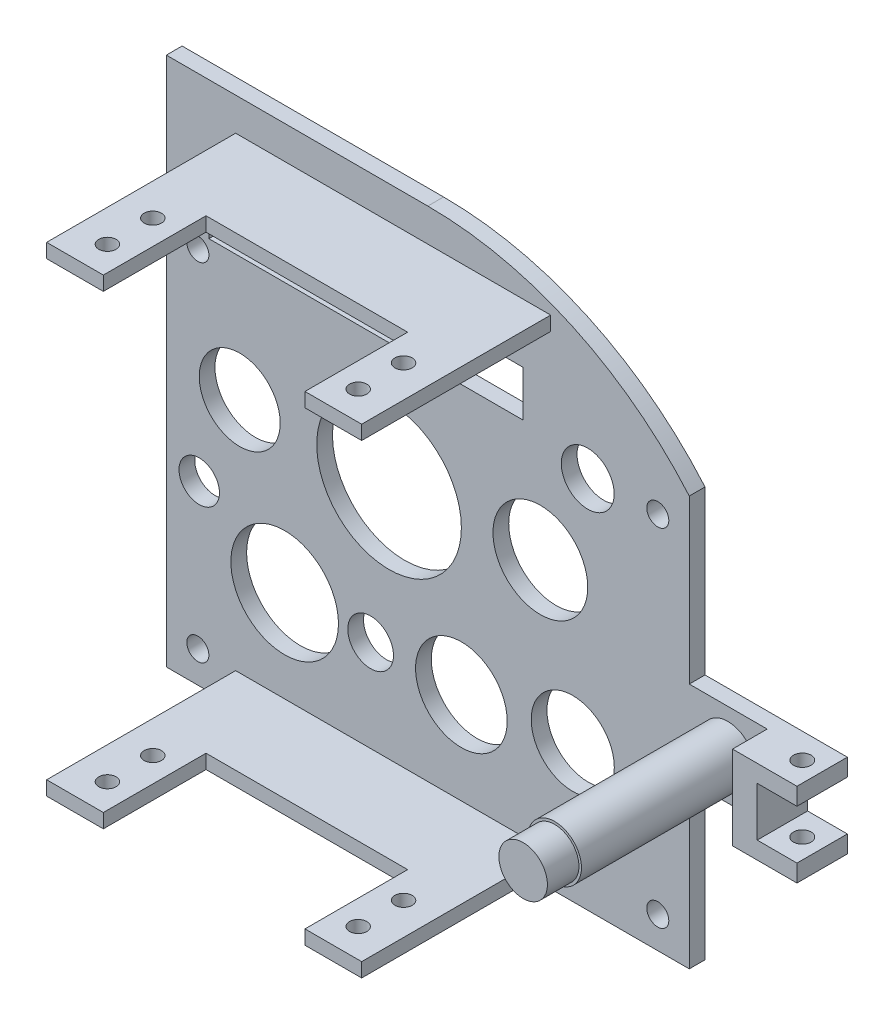
from build123d import *

# Parameters (mm, degrees)
SKETCH1_R                      = 1.75
BOSS_EXTRUDE1_DEPTH            = 2.5
CUT_EXTRUDE1_DEPTH             = 72.5
SKETCH3_3_W                    = 50
SKETCH3_3_H                    = 2.25
BOSS_EXTRUDE2_DEPTH            = 30
SKETCH6_R                      = 1.375
SKETCH6_W                      = 32
SKETCH6_H                      = 16.3
CUT_EXTRUDE2_DEPTH             = 105.230334086
SKETCH2_R                      = 4.25
BOSS_EXTRUDE4_DEPTH            = 27.5
SKETCH7_R                      = 3.85
BOSS_EXTRUDE5_DEPTH            = 5
BOSS_EXTRUDE6_DEPTH            = 5.5
CUT_EXTRUDE3_REACH             = 83.788
SKETCH10_R                     = 1.4
CUT_EXTRUDE3_DIRECTION_2_REACH = 83.788
SKETCH11_R                     = 8.539861485
SKETCH11_R_2                   = 11.48003937
SKETCH11_R_3                   = 7.272091534
SKETCH11_R_4                   = 7.519806812
SKETCH11_R_5                   = 6.595679845
SKETCH11_R_6                   = 6.427948737
SKETCH11_R_7                   = 4.197397556
SKETCH11_R_8                   = 3.623122109
SKETCH11_R_9                   = 3.210730166
CUT_EXTRUDE4_DEPTH             = 5.5


with BuildPart() as part:
    # Sketch1 → Boss-Extrude1 (new body)
    with BuildSketch(Plane.XY):
        with BuildLine():
            Line((-56.464809788, 28.68976821), (-56.464809788, -36.31023179))
            Line((-56.464809788, -36.31023179), (26.535190212, -36.31023179))
            Line((26.535190212, -36.31023179), (26.535190212, -10.463256981))
            Line((26.535190212, -10.463256981), (49.126360761, -10.463256981))
            Line((49.126360761, -10.463256981), (49.126360761, -7.713256981))
            Line((49.126360761, -7.713256981), (42.816561641, -7.713256981))
            Line((42.816561641, -7.713256981), (42.816561641, 0.0927934))
            Line((42.816561641, 0.0927934), (49.126360761, 0.0927934))
            Line((49.126360761, 0.0927934), (49.126360761, 2.8427934))
            Line((49.126360761, 2.8427934), (26.535190212, 2.8427934))
            Line((26.535190212, 2.8427934), (26.535190212, 28.68976821))
            ThreePointArc((26.535190212, 28.68976821), (7.879441831, 42.792705368), (-14.964809788, 47.799695688))
            Line((-14.964809788, 47.799695688), (-56.464809788, 47.799695688))
            Line((-56.464809788, 47.799695688), (-56.464809788, 28.68976821))
        make_face()
        with Locations((-51.464809788, 23.68976821)):
            Circle(SKETCH1_R, mode=Mode.SUBTRACT)
        with Locations((21.535190212, 23.68976821)):
            Circle(SKETCH1_R, mode=Mode.SUBTRACT)
        with Locations((21.535190212, -31.31023179)):
            Circle(SKETCH1_R, mode=Mode.SUBTRACT)
        with Locations((-51.464809788, -31.31023179)):
            Circle(SKETCH1_R, mode=Mode.SUBTRACT)
    extrude(amount=BOSS_EXTRUDE1_DEPTH)

    # Sketch3 → Cut-Extrude1 (cut)
    with BuildSketch(Plane.XY.offset(2.5)):
        Polygon((-45.464809788, 33.189405095), (0.160752733, 33.189405095), (0.160752733, 25.939405095), (-45.464809788, 25.939405095), (-49.713634909, 25.939405095), (-49.713634909, 33.189405095), align=None)
    extrude(amount=-CUT_EXTRUDE1_DEPTH, mode=Mode.SUBTRACT)

    # Sketch3<3> → Boss-Extrude2 (add)
    with BuildSketch(Plane.XY.offset(2.5)):
        with Locations((-20.464809788, -32.43523179)):
            Rectangle(SKETCH3_3_W, SKETCH3_3_H)
        with Locations((-20.464809788, 41.439405095)):
            Rectangle(SKETCH3_3_W, SKETCH3_3_H)
    extrude(amount=BOSS_EXTRUDE2_DEPTH)

    # Sketch6 → Cut-Extrude2 (cut, through all)
    with BuildSketch(Plane.XZ.offset(33.56023179)):
        with Locations((-40.364809788, 27.95)):
            Circle(SKETCH6_R)
        with Locations((-40.364809788, 20.75)):
            Circle(SKETCH6_R)
        with Locations((-0.564809788, 20.75)):
            Circle(SKETCH6_R)
        with Locations((-0.564809788, 27.95)):
            Circle(SKETCH6_R)
        with Locations((-20.464809788, 24.35)):
            Rectangle(SKETCH6_W, SKETCH6_H)
    extrude(amount=-CUT_EXTRUDE2_DEPTH, mode=Mode.SUBTRACT)

    # Sketch2 → Boss-Extrude4 (add)
    with BuildSketch(Plane.XY.offset(2.5)):
        with Locations((32.668616658, -3.474392223)):
            Circle(SKETCH2_R)
    extrude(amount=BOSS_EXTRUDE4_DEPTH)

    # Sketch7 → Boss-Extrude5 (add)
    with BuildSketch(Plane.XY.offset(30)):
        with Locations((32.668616658, -3.474392223)):
            Circle(SKETCH7_R)
    extrude(amount=BOSS_EXTRUDE5_DEPTH)

    # Sketch8 → Boss-Extrude6 (add)
    with BuildSketch(Plane.XY.offset(2.5)):
        Polygon((49.126360761, 2.8427934), (38.901417253, 2.8427934), (38.901417253, -10.463256981), (49.126360761, -10.463256981), (49.126360761, -7.713256981), (42.816561641, -7.713256981), (42.816561641, 0.0927934), (49.126360761, 0.0927934), align=None)
    extrude(amount=BOSS_EXTRUDE6_DEPTH)

    # Sketch10 → Cut-Extrude3 (cut, up to next)
    with BuildSketch(Plane.XZ.offset(-0.0927934), mode=Mode.PRIVATE) as cut_extrude3_sk1:
        with Locations((45.971461201, 4)):
            Circle(SKETCH10_R)
    cut_extrude3_tool1 = extrude(cut_extrude3_sk1.sketch, amount=-CUT_EXTRUDE3_REACH, mode=Mode.PRIVATE) & part.part
    add(cut_extrude3_tool1.solids().sort_by_distance((45.971461, 0.092793, 4))[0], mode=Mode.SUBTRACT)

    # Sketch10 → Cut-Extrude3 direction 2 (cut, up to next)
    with BuildSketch(Plane.XZ.offset(-0.0927934), mode=Mode.PRIVATE) as cut_extrude3_direction_2_sk1:
        with Locations((45.971461201, 4)):
            Circle(SKETCH10_R)
    cut_extrude3_direction_2_tool1 = extrude(cut_extrude3_direction_2_sk1.sketch, amount=CUT_EXTRUDE3_DIRECTION_2_REACH, mode=Mode.PRIVATE) & part.part
    add(cut_extrude3_direction_2_tool1.solids().sort_by_distance((45.971461, 0.092793, 4))[0], mode=Mode.SUBTRACT)

    # Sketch11 → Cut-Extrude4 (cut)
    with BuildSketch(Plane.XY.offset(2.5)):
        with Locations((-37.685497527, -16.705468454)):
            Circle(SKETCH11_R)
        with Locations((-21.117750948, 6.238516068)):
            Circle(SKETCH11_R_2)
        with Locations((-9.637711577, -16.705468454)):
            Circle(SKETCH11_R_3)
        with Locations((2.898597996, 8.08771742)):
            Circle(SKETCH11_R_4)
        with Locations((8.040859787, -14.56610874)):
            Circle(SKETCH11_R_5)
        with Locations((-44.818935978, 6.238516068)):
            Circle(SKETCH11_R_6)
        with Locations((10.418404807, 23.017872193)):
            Circle(SKETCH11_R_7)
        with Locations((-24.041815555, -16.705468454)):
            Circle(SKETCH11_R_8)
        with Locations((-51.246884715, -8.165606969)):
            Circle(SKETCH11_R_9)
    extrude(amount=-CUT_EXTRUDE4_DEPTH, mode=Mode.SUBTRACT)


solid = part.part
